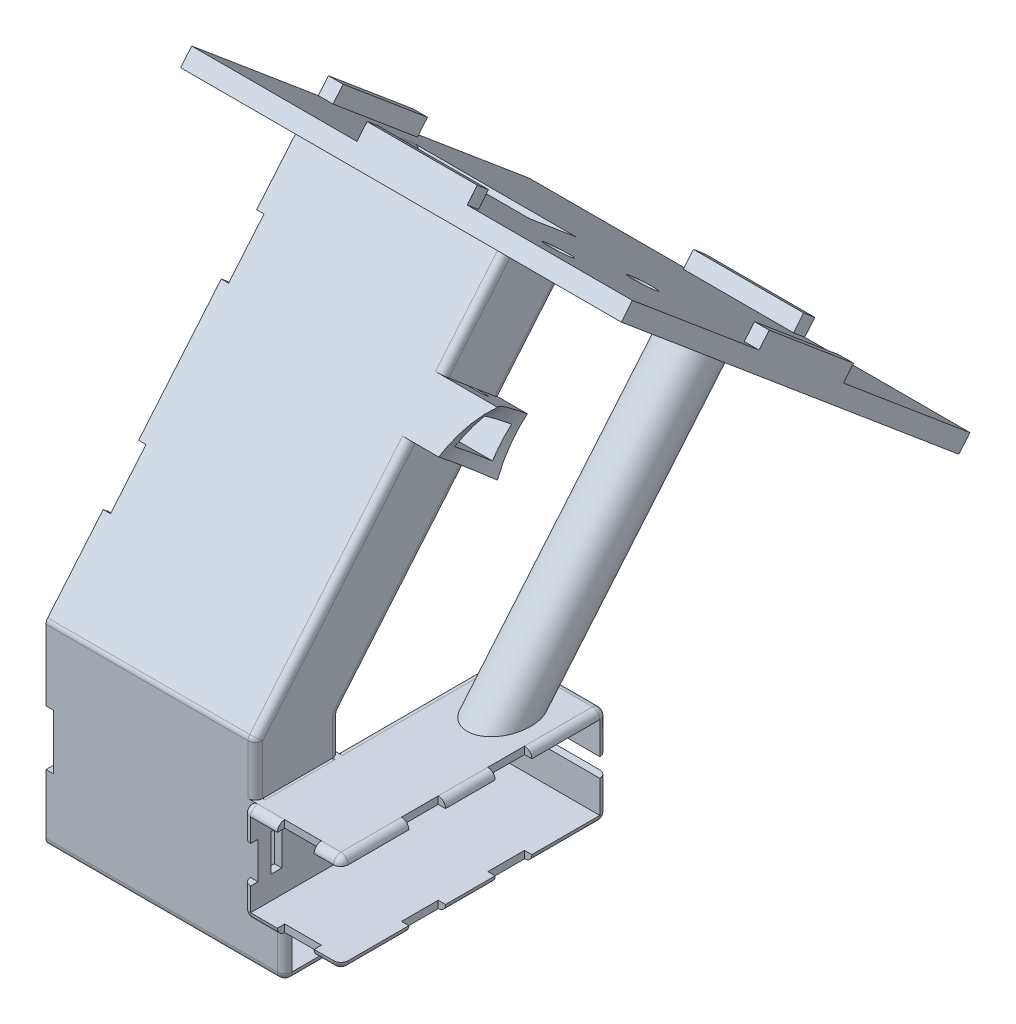
from build123d import *

# Parameters (mm, degrees)
SKETCH1_W                             = 24.6
SKETCH1_H                             = 22.6
BOSS_EXTRUDE3_DEPTH                   = 2
BOSS_EXTRUDE4_DEPTH                   = 72.5
SKETCH2_W                             = 14.25
SKETCH2_H                             = 5.1
CUT_EXTRUDE1_DEPTH                    = 2
SKETCH3_R                             = 3
SKETCH3_W                             = 3
SKETCH3_H                             = 10
CUT_EXTRUDE2_DEPTH                    = 2
FILLET1_R                             = 2
SKETCH4_W                             = 10
SKETCH4_H                             = 2
SKETCH4_W_2                           = 2
SKETCH4_H_2                           = 10
CUT_EXTRUDE3_DEPTH                    = 2
SKETCH5_W                             = 10
SKETCH5_H                             = 2
CUT_EXTRUDE4_DEPTH                    = 2
FILLET2_R                             = 2
BOSS_EXTRUDE10_DEPTH                  = 95
BOSS_EXTRUDE10_DEPTH_BACK             = 33
SKETCH14_R                            = 7.5
SKETCH14_R_2                          = 5
CUT_EXTRUDE7_DEPTH                    = 56.7
CUT_EXTRUDE7_DEPTH_BACK               = 70
SKETCH17_W                            = 24.6
SKETCH17_H                            = 22.6
SKETCH17_H_2                          = 50
SKETCH18_W                            = 120
SKETCH18_H                            = 120
BOSS_EXTRUDE11_DEPTH                  = 4.7
SKETCH21_R                            = 3.55
CUT_EXTRUDE8_DEPTH                    = 4.7
SKETCH22_W                            = 14
SKETCH22_H                            = 20.5
SKETCH22_W_2                          = 8
SKETCH22_H_2                          = 14.5
BOSS_EXTRUDE12_DEPTH                  = 53
BOSS_EXTRUDE12_DIRECTION_2_REACH      = 164.158
BOSS_EXTRUDE12_DIRECTION_2_END_RADIUS = 22
BOSS_EXTRUDE16_DEPTH                  = 65
BOSS_EXTRUDE17_REACH                  = 187.271
SKETCH30_W                            = 57.7
SKETCH30_H                            = 2
BOSS_EXTRUDE18_REACH                  = 187.271
SKETCH30_3_W                          = 57.7
SKETCH30_3_H                          = 2
BOSS_EXTRUDE19_DEPTH                  = 57
CUT_EXTRUDE12_DEPTH                   = 31
SKETCH37_R                            = 3.5
CUT_EXTRUDE14_DEPTH                   = 3
CUT_EXTRUDE15_DEPTH                   = 3
BOSS_EXTRUDE20_DEPTH                  = 2
SKETCH41_W                            = 2
SKETCH41_H                            = 15
SKETCH41_W_2                          = 10
SKETCH41_H_2                          = 2
CUT_EXTRUDE16_DEPTH                   = 2
SKETCH42_W                            = 40
SKETCH42_H                            = 16.5
CUT_EXTRUDE17_DEPTH                   = 4.7
FILLET3_R                             = 2
SKETCH43_W                            = 30
SKETCH43_H                            = 4
SKETCH43_W_2                          = 4
SKETCH43_H_2                          = 30
BOSS_EXTRUDE21_DEPTH                  = 4.3
SKETCH44_R                            = 1.75
CUT_EXTRUDE18_DEPTH                   = 2


# Some blends are built 0.0001 mm under size
with BuildPart() as part:
    # Sketch1 → Boss-Extrude3 (new body)
    with BuildSketch(Plane.XY):
        Rectangle(SKETCH1_W, SKETCH1_H)
        Polygon((12.3, -11.3), (-12.3, -11.3), (-12.3, 11.3), (12.3, 11.3), (12.3, 13.3), (-14.3, 13.3), (-14.3, -13.3), (12.3, -13.3), align=None)
    extrude(amount=BOSS_EXTRUDE3_DEPTH)

    # Sketch1<7> → Boss-Extrude4 (add)
    with BuildSketch(Plane.XY):
        Polygon((12.3, -11.3), (-12.3, -11.3), (-12.3, 11.3), (12.3, 11.3), (12.3, 13.3), (-14.3, 13.3), (-14.3, -13.3), (12.3, -13.3), align=None)
    extrude(amount=BOSS_EXTRUDE4_DEPTH)

    # Sketch2 → Cut-Extrude1 (cut)
    with BuildSketch(Plane(origin=(0, 0, 0), x_dir=(-1, 0, 0), z_dir=(0, 0, -1))):
        with Locations((-5.175, 0)):
            Rectangle(SKETCH2_W, SKETCH2_H)
    extrude(amount=-CUT_EXTRUDE1_DEPTH, mode=Mode.SUBTRACT)

    # Sketch3 → Cut-Extrude2 (cut)
    with BuildSketch(Plane(origin=(-12.3, 0, 0), x_dir=(0, 0, -1), z_dir=(1, 0, 0))):
        with Locations((-13.2, 0)):
            Circle(SKETCH3_R)
        with Locations((-65.5, 0)):
            Rectangle(SKETCH3_W, SKETCH3_H)
    extrude(amount=-CUT_EXTRUDE2_DEPTH, mode=Mode.SUBTRACT)

    # Fillet1
    fillet1_edges = [part.edges().sort_by_distance(p)[0] for p in [
        (-14.3, 0, 0),
        (-1, 13.3, 0),
        (-1, -13.3, 0),
        (-14.3, -13.3, 36.25),
        (-14.3, 13.3, 36.25),
    ]]
    fillet(fillet1_edges, radius=FILLET1_R)

    # Sketch4 → Cut-Extrude3 (cut)
    with BuildSketch(Plane.XY.offset(72.5)):
        with Locations((0, -12.3)):
            Rectangle(SKETCH4_W, SKETCH4_H)
        with Locations((0, 12.3)):
            Rectangle(SKETCH4_W, SKETCH4_H)
        with Locations((-13.3, 0)):
            Rectangle(SKETCH4_W_2, SKETCH4_H_2)
    extrude(amount=-CUT_EXTRUDE3_DEPTH, mode=Mode.SUBTRACT)

    # Sketch5 → Cut-Extrude4 (cut)
    with BuildSketch(Plane(origin=(12.3, 0, 0), x_dir=(0, 0, -1), z_dir=(1, 0, 0))):
        with Locations((-25.5, 12.3)):
            Rectangle(SKETCH5_W, SKETCH5_H)
        with Locations((-49, 12.3)):
            Rectangle(SKETCH5_W, SKETCH5_H)
        with Locations((-49, -12.3)):
            Rectangle(SKETCH5_W, SKETCH5_H)
        with Locations((-25.5, -12.3)):
            Rectangle(SKETCH5_W, SKETCH5_H)
    extrude(amount=-CUT_EXTRUDE4_DEPTH, mode=Mode.SUBTRACT)

    # Fillet2
    fillet2_edges = [part.edges().sort_by_distance(p)[0] for p in [
        (12.3, -6.925, 0),
        (12.3, -13.3, 11.25),
        (12.3, -12.714213562, 0.585786438),
    ]]
    fillet(fillet2_edges, radius=FILLET2_R - 0.0001)  # a hair under: the kernel refuses the full size
    fillet2_2_edges = [part.edges().sort_by_distance(p)[0] for p in [
        (12.3, 6.925, 0),
        (12.3, 12.714213562, 0.585786438),
        (12.3, 13.3, 11.25),
    ]]
    fillet(fillet2_2_edges, radius=FILLET2_R)
    fillet2_3_edges = [part.edges().sort_by_distance(p)[0] for p in [
        (12.3, -13.3, 37.25),
    ]]
    fillet(fillet2_3_edges, radius=FILLET2_R - 0.0001)  # a hair under: the kernel refuses the full size
    fillet2_4_edges = [part.edges().sort_by_distance(p)[0] for p in [
        (12.3, -13.3, 63.25),
    ]]
    fillet(fillet2_4_edges, radius=FILLET2_R - 0.0001)  # a hair under: the kernel refuses the full size
    fillet2_5_edges = [part.edges().sort_by_distance(p)[0] for p in [
        (7.65005, -13.3, 72.5),
    ]]
    fillet(fillet2_5_edges, radius=FILLET2_R - 0.0001)  # a hair under: the kernel refuses the full size
    fillet2_6_edges = [part.edges().sort_by_distance(p)[0] for p in [
        (-8.65, -13.3, 72.5),
        (-13.714213562, -12.714213562, 72.5),
        (-14.3, -8.15, 72.5),
    ]]
    fillet(fillet2_6_edges, radius=FILLET2_R - 0.0001)  # a hair under: the kernel refuses the full size
    fillet2_7_edges = [part.edges().sort_by_distance(p)[0] for p in [
        (-8.65, 13.3, 72.5),
        (-14.3, 8.15, 72.5),
        (-13.714213562, 12.714213562, 72.5),
    ]]
    fillet(fillet2_7_edges, radius=FILLET2_R - 0.0001)  # a hair under: the kernel refuses the full size
    fillet2_8_edges = [part.edges().sort_by_distance(p)[0] for p in [
        (8.65, 13.3, 72.5),
    ]]
    fillet(fillet2_8_edges, radius=FILLET2_R - 0.0001)  # a hair under: the kernel refuses the full size
    fillet2_9_edges = [part.edges().sort_by_distance(p)[0] for p in [
        (12.3, 13.3, 62.25005),
    ]]
    fillet(fillet2_9_edges, radius=FILLET2_R - 0.0001)  # a hair under: the kernel refuses the full size
    fillet2_10_edges = [part.edges().sort_by_distance(p)[0] for p in [
        (12.3, 13.3, 37.25),
    ]]
    fillet(fillet2_10_edges, radius=FILLET2_R - 0.0001)  # a hair under: the kernel refuses the full size

    # Sketch14 → Boss-Extrude10 (add, two sides: drawn at the far end of the back side and taken through both)
    with BuildSketch(Plane(origin=(0, -7.615919957, 6.390515627), x_dir=(-1, 0, 0), z_dir=(0, 0.7660444431189771, -0.6427876096865406)).offset(-BOSS_EXTRUDE10_DEPTH_BACK)):
        with Locations(Location((1, 20.081164095, 0), (0, 0, 270))):
            Circle(SKETCH14_R)
        with Locations(Location((1, 20.081164095, 0), (0, 0, 90))):
            Circle(SKETCH14_R_2, mode=Mode.SUBTRACT)
    extrude(amount=BOSS_EXTRUDE10_DEPTH + BOSS_EXTRUDE10_DEPTH_BACK)

    # Sketch17 → Cut-Extrude7 (cut, two sides: drawn at the far end of the back side and taken through both)
    with BuildSketch(Plane.XY.offset(72.5).offset(-CUT_EXTRUDE7_DEPTH_BACK)):
        Rectangle(SKETCH17_W, SKETCH17_H)
        with Locations((0, -38.3)):
            Rectangle(SKETCH17_W, SKETCH17_H_2)
    extrude(amount=CUT_EXTRUDE7_DEPTH + CUT_EXTRUDE7_DEPTH_BACK, mode=Mode.SUBTRACT)

    # Sketch18 → Boss-Extrude11 (add)
    with BuildSketch(Plane(origin=(0, 65.158302139, -54.674307293), x_dir=(-1, 0, 0), z_dir=(0, 0.766044443118977, -0.6427876096865405))):
        with Locations((12.3, 52.555208449)):
            Rectangle(SKETCH18_W, SKETCH18_H)
    extrude(amount=BOSS_EXTRUDE11_DEPTH)

    # Sketch21 → Cut-Extrude8 (cut)
    with BuildSketch(Plane(origin=(0, 65.158302139, -54.674307293), x_dir=(1, 0, 0), z_dir=(0, -0.7660444431189769, 0.6427876096865407))):
        with Locations(Location((15.999999996, 67.555208449, 0), (0, 0, 270))):
            Circle(SKETCH21_R)
        with Locations(Location((15.999999996, 97.555208449, 0), (0, 0, 270))):
            Circle(SKETCH21_R)
    extrude(amount=-CUT_EXTRUDE8_DEPTH, mode=Mode.SUBTRACT)

    # Sketch29 → Boss-Extrude16 (add)
    with BuildSketch(Plane(origin=(-5, 0, 0), x_dir=(0, 0, -1), z_dir=(1, 0, 0))):
        Polygon((-70.5, -13.3), (-68.5, -13.3), (-68.5, -23.6), (-49.5, -23.6), (-49.5, -13.3), (-47.5, -13.3), (-47.5, -25.6), (-70.5, -25.6), align=None)
    extrude(amount=-BOSS_EXTRUDE16_DEPTH)

    # Boss-Extrude17: up to this plane
    boss_extrude17_end = Plane(origin=(-59.000000004, 64.551313015, 12.733348872), z_dir=(0, 0.6427876096865405, 0.7660444431189771))
    # Sketch30 → Boss-Extrude17 (add, up to the surface)
    with BuildSketch(Plane(origin=(0, -13.3, 0), x_dir=(1, 0, 0), z_dir=(0, 1, 0)), mode=Mode.PRIVATE) as boss_extrude17_sk1:
        with Locations((-41.15, -48.5)):
            Rectangle(SKETCH30_W, SKETCH30_H)
    boss_extrude17_tool1 = split(extrude(boss_extrude17_sk1.sketch, amount=BOSS_EXTRUDE17_REACH, mode=Mode.PRIVATE), bisect_by=boss_extrude17_end, keep=Keep.BOTH, mode=Mode.PRIVATE)
    add(boss_extrude17_tool1.solids().sort_by_distance((-41.15, -13.3, 48.5))[0])

    # Boss-Extrude18: up to this plane
    boss_extrude18_end = Plane(origin=(-59.000000004, 77.728459013, 28.437259956), z_dir=(0, -0.6427876096865406, -0.766044443118977))
    # Sketch30<3> → Boss-Extrude18 (add, up to the surface)
    with BuildSketch(Plane(origin=(0, -13.3, 0), x_dir=(1, 0, 0), z_dir=(0, 1, 0)), mode=Mode.PRIVATE) as boss_extrude18_sk1:
        with Locations((-41.15, -69.5)):
            Rectangle(SKETCH30_3_W, SKETCH30_3_H)
    boss_extrude18_tool1 = split(extrude(boss_extrude18_sk1.sketch, amount=BOSS_EXTRUDE18_REACH, mode=Mode.PRIVATE), bisect_by=boss_extrude18_end, keep=Keep.BOTH, mode=Mode.PRIVATE)
    add(boss_extrude18_tool1.solids().sort_by_distance((-41.15, -13.3, 69.5))[0])



with BuildPart() as body_2:
    # Sketch22 → Boss-Extrude12 (new body)
    with BuildSketch(Plane(origin=(-6.000000004, 112.182361983, -5.945117023), x_dir=(0, -0.7660444431189769, 0.6427876096865408), z_dir=(-1, 0, 0))):
        with Locations((41.493786827, -6.058113108)):
            Rectangle(SKETCH22_W, SKETCH22_H)
        with Locations((41.493786827, -6.058113108)):
            Rectangle(SKETCH22_W_2, SKETCH22_H_2, mode=Mode.SUBTRACT)
    extrude(amount=BOSS_EXTRUDE12_DEPTH)

    # Boss-Extrude12 direction 2: up to this cylinder (the profile starts outside it)
    boss_extrude12_direction_2_end = Plane(origin=(15.999999996, 71.583302536, 20.425736), z_dir=(0, 0, 1)) * Cylinder(BOSS_EXTRUDE12_DIRECTION_2_END_RADIUS, 373.316, mode=Mode.PRIVATE)
    # Sketch22 → Boss-Extrude12 direction 2 (add, up to the surface)
    with BuildSketch(Plane(origin=(-6.000000004, 112.182361983, -5.945117023), x_dir=(0, -0.7660444431189769, 0.6427876096865408), z_dir=(-1, 0, 0)), mode=Mode.PRIVATE) as boss_extrude12_direction_2_sk1:
        with Locations((41.493786827, -6.058113108)):
            Rectangle(SKETCH22_W, SKETCH22_H)
        with Locations((41.493786827, -6.058113108)):
            Rectangle(SKETCH22_W_2, SKETCH22_H_2, mode=Mode.SUBTRACT)
    boss_extrude12_direction_2_tool1 = extrude(boss_extrude12_direction_2_sk1.sketch, amount=-BOSS_EXTRUDE12_DIRECTION_2_REACH, mode=Mode.PRIVATE) - boss_extrude12_direction_2_end
    add(boss_extrude12_direction_2_tool1.solids().sort_by_distance((-6, 71.330052, 20.425736))[0])
    add(boss_extrude12_direction_2_tool1.solids().sort_by_distance((-6, 71.330052, 20.425736))[1])


with BuildPart() as part_1:
    add(part.part)

    add(body_2.part)  # Boss-Extrude19 merges body 2
    # Sketch34 → Boss-Extrude19 (add)
    with BuildSketch(Plane.ZY.offset(70)):
        Polygon((49.5, 20.734524445), (-15.416754682, 98.099300057), (-13.884665796, 99.384875276), (49.5, 23.845972099), align=None)
        Polygon((70.5, 27.600037451), (68.967911114, 26.314462232), (-1.244932484, 109.990870836), (0.287156402, 111.276446055), align=None)
    extrude(amount=-BOSS_EXTRUDE19_DEPTH)

    # Sketch36 → Cut-Extrude12 (cut)
    with BuildSketch(Plane.XY.offset(70.5)):
        Polygon((10.3, 29.983544636), (-13, 29.983544636), (-13, 13.3), (-5, 13.3), (5, 13.3), (10.3, 13.3), align=None)
    extrude(amount=-CUT_EXTRUDE12_DEPTH, mode=Mode.SUBTRACT)

    # Sketch37 → Cut-Extrude14 (cut)
    with BuildSketch(Plane(origin=(0, 31.610315098, -26.52420374), x_dir=(1, 0, 0), z_dir=(0, -0.7660444431189769, 0.6427876096865408))):
        with Locations(Location((-39.11643127, 61.64709534, 0), (0, 0, 270))):
            Circle(SKETCH37_R)
    extrude(amount=-CUT_EXTRUDE14_DEPTH, mode=Mode.SUBTRACT)

    # Sketch38 → Cut-Extrude15 (cut)
    with BuildSketch(Plane(origin=(0, 40.036803972, -33.594867446), x_dir=(1, 0, 0), z_dir=(0, -0.7660444431189768, 0.6427876096865407))):
        with BuildLine():
            Line((-10.124323706, 63.14709534), (-39.11643127, 63.14709534))
            Line((-39.11643127, 63.14709534), (-50.124323706, 63.14709534))
            ThreePointArc((-50.124323706, 63.14709534), (-51.624323706, 61.64709534), (-50.124323706, 60.14709534))
            Line((-50.124323706, 60.14709534), (-39.11643127, 60.14709534))
            Line((-39.11643127, 60.14709534), (-10.124323706, 60.14709534))
            ThreePointArc((-10.124323706, 60.14709534), (-8.624323706, 61.64709534), (-10.124323706, 63.14709534))
        make_face()
    extrude(amount=-CUT_EXTRUDE15_DEPTH, mode=Mode.SUBTRACT)

    # Sketch39 → Boss-Extrude20 (add)
    with BuildSketch(Plane(origin=(-13, 0, 0), x_dir=(0, 0, -1), z_dir=(1, 0, 0))):
        Polygon((-3.734322336, 75.275935218), (-19.43823342, 88.453081217), (-0.287156402, 111.276446055), (15.416754682, 98.099300057), align=None)
        Polygon((-68.5, 13.3), (-47.5, 13.3), (-47.5, 23.11803163), (-12.733348872, 64.551313015), (-26.905171069, 76.442883794), (-68.5, 26.872096983), align=None)
    extrude(amount=-BOSS_EXTRUDE20_DEPTH)

    # Sketch41 → Cut-Extrude16 (cut)
    with BuildSketch(Plane.ZY.offset(70)):
        Polygon((13.142908596, 95.955557193), (22.784722741, 84.464890546), (21.252633855, 83.179315327), (11.61081971, 94.669981974), align=None)
        with Locations((48.5, 0.122986049)):
            Rectangle(SKETCH41_W, SKETCH41_H)
        Polygon((45.28228908, 57.653335037), (54.924103225, 46.16266839), (53.392014339, 44.877093171), (43.750200194, 56.367759818), align=None)
        Polygon((31.110466882, 45.761764258), (40.752281028, 34.271097611), (39.220192141, 32.985522392), (29.578377996, 44.476189038), align=None)
        Polygon((-1.028913602, 84.063986414), (8.612900543, 72.573319767), (7.080811657, 71.287744548), (-2.561002488, 82.778411194), align=None)
        with Locations((69.5, 0.122986049)):
            Rectangle(SKETCH41_W, SKETCH41_H)
        with Locations((59, -24.6)):
            Rectangle(SKETCH41_W_2, SKETCH41_H_2)
    extrude(amount=-CUT_EXTRUDE16_DEPTH, mode=Mode.SUBTRACT)

    # Sketch42 → Cut-Extrude17 (cut)
    with BuildSketch(Plane(origin=(0, 68.758711022, -57.695409059), x_dir=(1, 0, 0), z_dir=(0, 0.7660444431189771, -0.6427876096865406))):
        with Locations((-35, -61.49709534)):
            Rectangle(SKETCH42_W, SKETCH42_H)
    extrude(amount=-CUT_EXTRUDE17_DEPTH, mode=Mode.SUBTRACT)

    # Fillet3
    # the kernel refuses this fillet: 2 mm, written as the material it adds along each edge
    with BuildSketch(Plane(origin=(-13, 23.11803163, 47.5), x_dir=(0, -1, 0), z_dir=(-1, 0, 0))) as fillet3_piece_1:
        with BuildLine():
            CenterArc((FILLET3_R * 0.363970234266, -FILLET3_R), FILLET3_R, 90, 40)
            Line((-FILLET3_R * 0.27881737542, -FILLET3_R * 0.233955556881), (0, 0))
            Line((0, 0), (FILLET3_R * 0.363970234266, 0))
        make_face()
    extrude(amount=57)
    with BuildSketch(Plane(origin=(-59.000000004, 65.836888234, 14.265437758), x_dir=(0, -0.766044443118976, 0.6427876096865418), z_dir=(1, 0, 0))) as fillet3_piece_2_section:
        with BuildLine():
            CenterArc((FILLET3_R, -FILLET3_R), FILLET3_R, 90, 90)
            Line((0, -FILLET3_R), (0, 0))
            Line((0, 0), (FILLET3_R, 0))
        make_face()
    fillet3_piece_2 = extrude(amount=49.000000004, mode=Mode.PRIVATE)
    fillet3_piece_2 = split(fillet3_piece_2, bisect_by=Plane(origin=(-13, 65.781824984, 14.894813582), z_dir=(-1, 0, 0)), keep=Keep.TOP, mode=Mode.PRIVATE)
    add(fillet3_piece_2)
    with BuildSketch(Plane(origin=(-10, 76.442883794, 26.905171069), x_dir=(0, -0.7660444431189772, 0.6427876096865401), z_dir=(-1, 0, 0))) as fillet3_piece_3_section:
        with BuildLine():
            CenterArc((FILLET3_R, -FILLET3_R), FILLET3_R, 90, 90)
            Line((0, -FILLET3_R), (0, 0))
            Line((0, 0), (FILLET3_R, 0))
        make_face()
    fillet3_piece_3 = extrude(amount=49.000000004, mode=Mode.PRIVATE)
    fillet3_piece_3 = split(fillet3_piece_3, bisect_by=Plane(origin=(-13, 75.81350797, 26.85010782), z_dir=(-1, 0, 0)), keep=Keep.TOP, mode=Mode.PRIVATE)
    add(fillet3_piece_3)
    # the kernel refuses this fillet: 2 mm, written as the material it takes off along each edge
    with BuildSketch(Plane(origin=(-15, 26.872096983, 68.5), x_dir=(0, 0.6427876096865409, 0.7660444431189768), z_dir=(1, 0, 0))) as fillet3_2_piece_1_section:
        Polygon((0, 0), (FILLET3_R * 1.02, 0), (FILLET3_R * 1.02, FILLET3_R * 0.371249638952), (FILLET3_R * 0.781365331981, FILLET3_R * 0.65564336188), align=None)
    fillet3_2_piece_1 = extrude(amount=FILLET3_R * 1.02, mode=Mode.PRIVATE)
    fillet3_2_piece_1 = fillet3_2_piece_1 - Plane(origin=(-15, 26.872096983, 68.5), x_dir=(0, -0.3420201433256697, -0.939692620785908), z_dir=(1, 0, 0)) * Sphere(FILLET3_R, mode=Mode.PRIVATE)
    add(fillet3_2_piece_1, mode=Mode.SUBTRACT)
    with BuildSketch(Plane(origin=(-7, -23.6, 68.5), x_dir=(1, 0, 0), z_dir=(0, 0, 1))) as fillet3_2_piece_2_section:
        Polygon((0, 0), (FILLET3_R * 1.02, 0), (FILLET3_R * 1.02, -FILLET3_R * 1.02), (0, -FILLET3_R * 1.02), align=None)
    fillet3_2_piece_2 = extrude(amount=FILLET3_R * 1.02, mode=Mode.PRIVATE)
    fillet3_2_piece_2 = fillet3_2_piece_2 - Plane(origin=(-7, -23.6, 68.5), x_dir=(-0.707106781186549, 0.7071067811865459, 0), z_dir=(0, 0, 1)) * Sphere(FILLET3_R, mode=Mode.PRIVATE)
    add(fillet3_2_piece_2, mode=Mode.SUBTRACT)
    with BuildSketch(Plane(origin=(-7, -23.6, 49.5), x_dir=(1, 0, 0), z_dir=(0, 0, -1))) as fillet3_2_piece_3_section:
        Polygon((0, 0), (FILLET3_R * 1.02, 0), (FILLET3_R * 1.02, FILLET3_R * 1.02), (0, FILLET3_R * 1.02), align=None)
    fillet3_2_piece_3 = extrude(amount=FILLET3_R * 1.02, mode=Mode.PRIVATE)
    fillet3_2_piece_3 = fillet3_2_piece_3 - Plane(origin=(-7, -23.6, 49.5), x_dir=(-0.707106781186549, 0.7071067811865459, 0), z_dir=(0, 0, -1)) * Sphere(FILLET3_R, mode=Mode.PRIVATE)
    add(fillet3_2_piece_3, mode=Mode.SUBTRACT)
    with BuildSketch(Plane(origin=(-13, 75.275935218, 3.734322336), x_dir=(-1, 0, 0), z_dir=(-1.6561840692654968e-15, 0.766044443118977, -0.6427876096865407)), Plane(origin=(-13, 111.276446055, 0.287156402), x_dir=(-1, 0, 0), z_dir=(1.6561840692654952e-15, -0.7660444431189762, 0.6427876096865415))) as fillet3_2_piece_4:
        with BuildLine():
            CenterArc((FILLET3_R, FILLET3_R), FILLET3_R, 180, 90)
            Line((0, FILLET3_R), (0, 0))
            Line((0, 0), (FILLET3_R, 0))
        make_face()
    extrude(amount=29.793786827, mode=Mode.SUBTRACT)
    with BuildSketch(Plane(origin=(-71.819851171, 27.600037451, 70.5), x_dir=(0, 0.7660444431189763, -0.6427876096865415), z_dir=(1, 0, 0))) as fillet3_2_piece_5:
        with BuildLine():
            CenterArc((FILLET3_R * 0.363970234266, -FILLET3_R), FILLET3_R, 90, 40)
            Line((-FILLET3_R * 0.27881737542, -FILLET3_R * 0.233955556881), (0, 0))
            Line((0, 0), (FILLET3_R * 0.363970234266, 0))
        make_face()
    extrude(amount=56.819851171, mode=Mode.SUBTRACT)
    with BuildSketch(Plane(origin=(-13, 26.872096983, 70.5), x_dir=(-1, 0, 0), z_dir=(0, -1, 0))) as fillet3_2_piece_6:
        with BuildLine():
            CenterArc((FILLET3_R, FILLET3_R), FILLET3_R, 180, 90)
            Line((0, FILLET3_R), (0, 0))
            Line((0, 0), (FILLET3_R, 0))
        make_face()
    extrude(amount=13.572096983, mode=Mode.SUBTRACT)
    with BuildSketch(Plane(origin=(-55, 113.591279719, -4.26603425), x_dir=(-1, 0, 0), z_dir=(0, -0.6427876096865406, -0.7660444431189771)), Plane(origin=(-55, 109.990870836, -1.244932484), x_dir=(0, 0.7660444431189771, -0.6427876096865406), z_dir=(0, -0.6427876096865406, -0.7660444431189771))) as fillet3_2_piece_7:
        with BuildLine():
            CenterArc((FILLET3_R, -FILLET3_R), FILLET3_R, 90, 90)
            Line((0, -FILLET3_R), (0, 0))
            Line((0, 0), (FILLET3_R, 0))
        make_face()
    extrude(amount=16.5, mode=Mode.SUBTRACT)
    with BuildSketch(Plane(origin=(-15, 102.985284159, -16.905767561), x_dir=(0, -0.7660444431189771, 0.6427876096865406), z_dir=(0, 0.6427876096865406, 0.7660444431189771))) as fillet3_2_piece_8:
        with BuildLine():
            CenterArc((FILLET3_R, FILLET3_R), FILLET3_R, 180, 90)
            Line((0, FILLET3_R), (0, 0))
            Line((0, 0), (FILLET3_R, 0))
        make_face()
    extrude(amount=16.5, mode=Mode.SUBTRACT)
    with BuildSketch(Plane(origin=(-13, 28.157672202, 70.032088886), x_dir=(-1, 0, 0), z_dir=(-1.5744473517818148e-15, 0.7660444431189771, -0.6427876096865406))) as fillet3_2_piece_9:
        with BuildLine():
            CenterArc((FILLET3_R, -FILLET3_R), FILLET3_R, 90, 90)
            Line((0, -FILLET3_R), (0, 0))
            Line((0, 0), (FILLET3_R, 0))
        make_face()
    extrude(amount=64.710066441, mode=Mode.SUBTRACT)
    with BuildSketch(Plane(origin=(-7, -25.6, 70.5), x_dir=(0, 1, 0), z_dir=(-1, 0, 0))) as fillet3_2_piece_10:
        with BuildLine():
            CenterArc((FILLET3_R, FILLET3_R), FILLET3_R, 180, 90)
            Line((0, FILLET3_R), (0, 0))
            Line((0, 0), (FILLET3_R, 0))
        make_face()
    extrude(amount=68, mode=Mode.SUBTRACT)
    with BuildSketch(Plane(origin=(-7, -25.6, 47.5), x_dir=(0, 1, 0), z_dir=(-1, 0, 0))) as fillet3_2_piece_11:
        with BuildLine():
            CenterArc((FILLET3_R, -FILLET3_R), FILLET3_R, 90, 90)
            Line((0, -FILLET3_R), (0, 0))
            Line((0, 0), (FILLET3_R, 0))
        make_face()
    extrude(amount=68, mode=Mode.SUBTRACT)
    with BuildSketch(Plane(origin=(-5, -23.6, 70.5), x_dir=(-1, 0, 0), z_dir=(0, 1, 0)), Plane(origin=(-5, -13.3, 47.5), x_dir=(-1, 0, 0), z_dir=(0, -1, 0))) as fillet3_2_piece_12:
        with BuildLine():
            CenterArc((FILLET3_R, -FILLET3_R), FILLET3_R, 90, 90)
            Line((0, -FILLET3_R), (0, 0))
            Line((0, 0), (FILLET3_R, 0))
        make_face()
    extrude(amount=10.3, mode=Mode.SUBTRACT)
    with BuildSketch(Plane(origin=(-5, -25.6, 49.5), x_dir=(0, 1, 0), z_dir=(0, 0, 1))) as fillet3_2_piece_13:
        with BuildLine():
            CenterArc((FILLET3_R, FILLET3_R), FILLET3_R, 180, 90)
            Line((0, FILLET3_R), (0, 0))
            Line((0, 0), (FILLET3_R, 0))
        make_face()
    extrude(amount=19, mode=Mode.SUBTRACT)
    # the kernel refuses this fillet: 2 mm, written as the material it adds along each edge
    with BuildSketch(Plane(origin=(-15, 98.099300057, -15.416754682), x_dir=(1.7188652031397261e-15, -0.7660444431189765, 0.6427876096865413), z_dir=(-1, 0, 0))) as fillet3_3_piece_1:
        with BuildLine():
            CenterArc((FILLET3_R, -FILLET3_R), FILLET3_R, 90, 90)
            Line((0, -FILLET3_R), (0, 0))
            Line((0, 0), (FILLET3_R, 0))
        make_face()
    extrude(amount=55)
    with BuildSketch(Plane(origin=(-15, 111.276446055, 0.287156402), x_dir=(1.0633897399286364e-15, -0.7660444431189679, 0.6427876096865515), z_dir=(-1, 0, 0))) as fillet3_3_piece_2:
        with BuildLine():
            CenterArc((FILLET3_R, FILLET3_R), FILLET3_R, 180, 90)
            Line((0, FILLET3_R), (0, 0))
            Line((0, 0), (FILLET3_R, 0))
        make_face()
    extrude(amount=55)
    with BuildSketch(Plane(origin=(-13, 109.990870836, -1.244932484), x_dir=(0, -0.7660444431189782, 0.6427876096865393), z_dir=(1.2131217439806658e-15, -0.6427876096865391, -0.7660444431189782))) as fillet3_3_piece_3:
        with BuildLine():
            CenterArc((FILLET3_R, -FILLET3_R), FILLET3_R, 90, 90)
            Line((0, -FILLET3_R), (0, 0))
            Line((0, 0), (FILLET3_R, 0))
        make_face()
    extrude(amount=16.5)
    with BuildSketch(Plane(origin=(-15, 109.990870836, -1.244932484), x_dir=(0, 0.6427876096865426, 0.7660444431189753), z_dir=(-1, 0, 0))) as fillet3_3_piece_4:
        with BuildLine():
            CenterArc((2 + FILLET3_R, -FILLET3_R), FILLET3_R, 90, 90)
            Line((2, -FILLET3_R), (2, 0))
            Line((2, 0), (2 + FILLET3_R, 0))
        make_face()
    revolve(axis=Axis((-15, 109.990870836, -1.244932484), (-1.6561840692654954e-15, 0.7660444431189762, -0.6427876096865415)), revolution_arc=90)
    with BuildSketch(Plane(origin=(-15, 99.384875276, -13.884665796), x_dir=(1.7763568394002473e-15, -0.6427876096865421, -0.7660444431189757), z_dir=(-1, 0, 0))) as fillet3_3_piece_5:
        with BuildLine():
            CenterArc((2 + FILLET3_R, FILLET3_R), FILLET3_R, 180, 90)
            Line((2 + FILLET3_R, 0), (2, 0))
            Line((2, 0), (2, FILLET3_R))
        make_face()
    revolve(axis=Axis((-15, 99.384875276, -13.884665796), (1.656184069265497e-15, -0.766044443118977, 0.6427876096865407)), revolution_arc=90)
    # the kernel refuses this fillet: 2 mm, written as the material it takes off along each edge
    with BuildSketch(Plane(origin=(-13, 64.551313015, 12.733348872), x_dir=(-1, 0, 0), z_dir=(1.609277464324292e-15, -0.7660444431189772, 0.6427876096865405))) as fillet3_4_piece_1:
        with BuildLine():
            CenterArc((FILLET3_R, -FILLET3_R), FILLET3_R, 90, 90)
            Line((0, -FILLET3_R), (0, 0))
            Line((0, 0), (FILLET3_R, 0))
        make_face()
    extrude(amount=53.359367072, mode=Mode.SUBTRACT)
    with BuildSketch(Plane(origin=(-13, 22.390091162, 47.5), x_dir=(-1, 0, 0), z_dir=(0, -1, 0))) as fillet3_4_piece_2:
        with BuildLine():
            CenterArc((FILLET3_R, -FILLET3_R), FILLET3_R, 90, 90)
            Line((0, -FILLET3_R), (0, 0))
            Line((0, 0), (FILLET3_R, 0))
        make_face()
    extrude(amount=9.090091162, mode=Mode.SUBTRACT)
    with BuildSketch(Plane(origin=(-13, 22.390091162, 45.5), x_dir=(0, 0, 1), z_dir=(0, -1, 0))) as fillet3_4_piece_3:
        with BuildLine():
            CenterArc((2 + FILLET3_R, FILLET3_R), FILLET3_R, 180, 90)
            Line((2 + FILLET3_R, 0), (2, 0))
            Line((2, 0), (2, FILLET3_R))
        make_face()
    revolve(axis=Axis((-13, 22.390091162, 45.5), (-1, 0, 0)), revolution_arc=40, mode=Mode.SUBTRACT)

    # Sketch43 → Boss-Extrude21 (add)
    with BuildSketch(Plane(origin=(0, 68.758711022, -57.695409059), x_dir=(1, 0, 0), z_dir=(0, 0.7660444431189771, -0.6427876096865406))):
        with Locations((-12.3, 5.444791551)):
            Rectangle(SKETCH43_W, SKETCH43_H)
        with Locations((45.7, -52.555208449)):
            Rectangle(SKETCH43_W_2, SKETCH43_H_2)
        with Locations((-12.3, -110.555208449)):
            Rectangle(SKETCH43_W, SKETCH43_H)
        with Locations((-70.3, -52.555208449)):
            Rectangle(SKETCH43_W_2, SKETCH43_H_2)
    extrude(amount=BOSS_EXTRUDE21_DEPTH)

    # Sketch44 → Cut-Extrude18 (cut)
    with BuildSketch(Plane.XZ.offset(25.6)):
        with Locations((-13, 52.4)):
            Circle(SKETCH44_R)
    extrude(amount=-CUT_EXTRUDE18_DEPTH, mode=Mode.SUBTRACT)


solid = part_1.part
